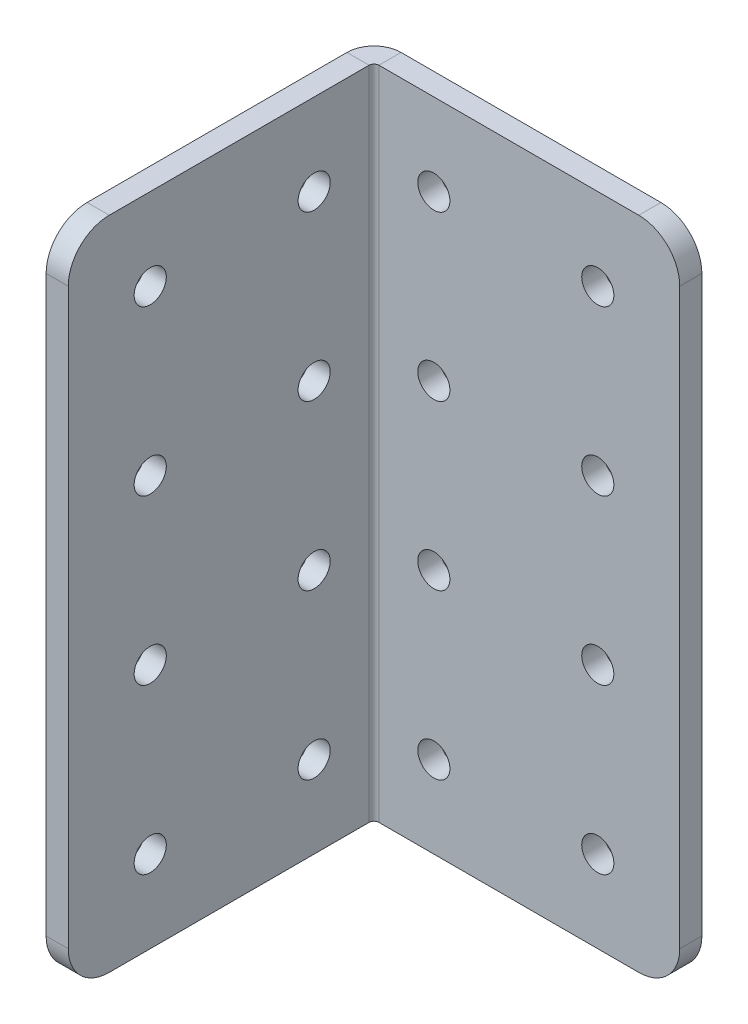
from build123d import *

# Parameters (mm, degrees)
BASE_FLANGE1_DEPTH = 101.6
SKETCH7_R          = 2.4892
CUT_EXTRUDE1_DEPTH = 125.434078933
SKETCH8_R          = 2.4892
CUT_EXTRUDE2_DEPTH = 125.434078933
FILLET1_R          = 6.35


# Sheet-metal steps are written as plain solids
with BuildPart() as part:
    # Sketch2 → Base-Flange1 (new body)
    with BuildSketch(Plane(origin=(0, 0, 0), x_dir=(1, 0, 0), z_dir=(0, 1, 0))):
        with BuildLine():
            Line((0, -50.8), (0, -4.191))
            ThreePointArc((0, -4.191), (1.22751548, -1.22751548), (4.191, 0))
            Line((4.191, 0), (50.8, 0))
            Line((50.8, 0), (50.8, -3.429))
            Line((50.8, -3.429), (4.191, -3.429))
            ThreePointArc((4.191, -3.429), (3.652184633, -3.652184633), (3.429, -4.191))
            Line((3.429, -4.191), (3.429, -50.8))
            Line((3.429, -50.8), (0, -50.8))
        make_face()
    extrude(amount=BASE_FLANGE1_DEPTH)

    # Sketch7 → Cut-Extrude1 (cut, through all)
    with BuildSketch(Plane.ZY):
        with Locations((38.1, 88.9)):
            Circle(SKETCH7_R)
        with Locations((12.7, 88.9)):
            Circle(SKETCH7_R)
        with Locations((12.7, 63.5)):
            Circle(SKETCH7_R)
        with Locations((12.7, 38.1)):
            Circle(SKETCH7_R)
        with Locations((12.7, 12.7)):
            Circle(SKETCH7_R)
        with Locations((38.1, 63.5)):
            Circle(SKETCH7_R)
        with Locations((38.1, 38.1)):
            Circle(SKETCH7_R)
        with Locations((38.1, 12.7)):
            Circle(SKETCH7_R)
    extrude(amount=-CUT_EXTRUDE1_DEPTH, mode=Mode.SUBTRACT)

    # Sketch8 → Cut-Extrude2 (cut, through all)
    with BuildSketch(Plane(origin=(0, 0, 0), x_dir=(-1, 0, 0), z_dir=(0, 0, -1))):
        with Locations((-38.1, 88.9)):
            Circle(SKETCH8_R)
        with Locations((-12.7, 88.9)):
            Circle(SKETCH8_R)
        with Locations((-12.7, 63.5)):
            Circle(SKETCH8_R)
        with Locations((-12.7, 38.1)):
            Circle(SKETCH8_R)
        with Locations((-12.7, 12.7)):
            Circle(SKETCH8_R)
        with Locations((-38.1, 63.5)):
            Circle(SKETCH8_R)
        with Locations((-38.1, 38.1)):
            Circle(SKETCH8_R)
        with Locations((-38.1, 12.7)):
            Circle(SKETCH8_R)
    extrude(amount=-CUT_EXTRUDE2_DEPTH, mode=Mode.SUBTRACT)

    # Fillet1
    fillet1_edges = [part.edges().sort_by_distance(p)[0] for p in [
        (1.7145, 101.6, 50.8),
        (1.7145, 0, 50.8),
        (50.8, 101.6, 1.7145),
        (50.8, 0, 1.7145),
    ]]
    fillet(fillet1_edges, radius=FILLET1_R)


solid = part.part
